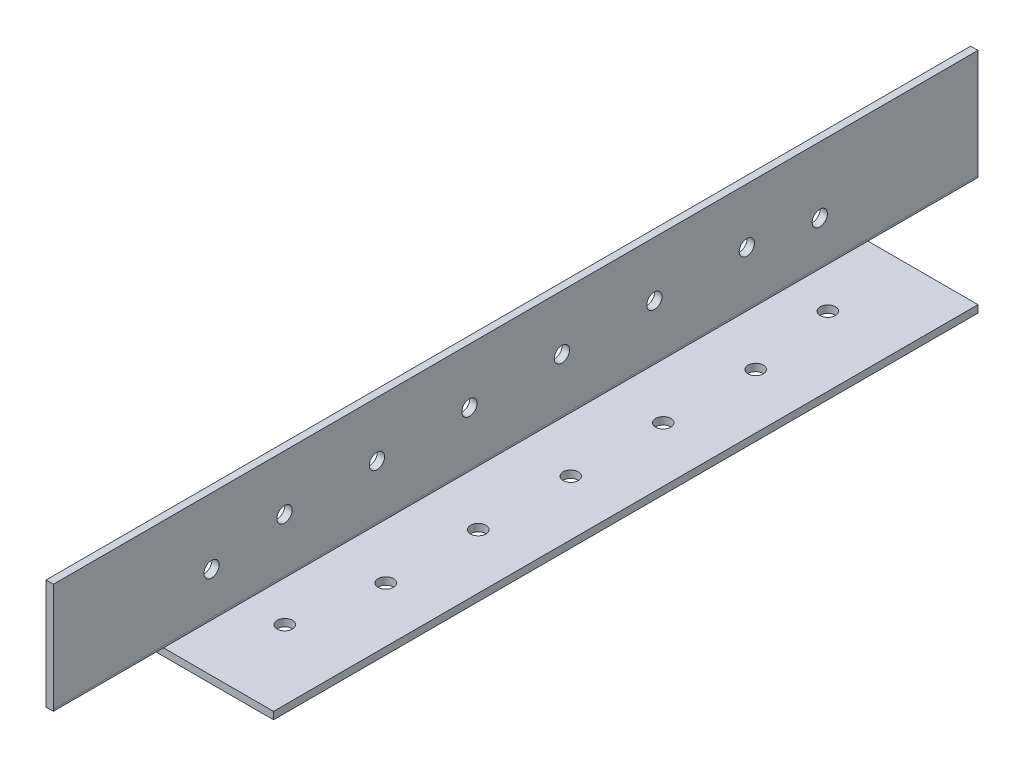
from build123d import *

# Parameters (mm, degrees)
BOSS_EXTRUDE1_DEPTH = 1219.2
FILLET1_R           = 0.254
SKETCH4_W           = 2238.4
SKETCH4_H           = 74.945320812
CUT_EXTRUDE1_DEPTH  = 60
SKETCH8_W           = 23.813
SKETCH8_H           = 23.813
CUT_EXTRUDE6_DEPTH  = 28.313
CUT_EXTRUDE7_DEPTH  = 228.313
SKETCH10_W          = 23.813
SKETCH10_H          = 1.587
CUT_EXTRUDE8_DEPTH  = 228.313
SKETCH14_R          = 1.65
CUT_EXTRUDE11_DEPTH = 60
SKETCH15_R          = 1.65
CUT_EXTRUDE12_DEPTH = 60


with BuildPart() as part:
    # Sketch3 → Boss-Extrude1 (new, symmetric)
    with BuildSketch(Plane.XY):
        Polygon((1.5875, 25.4), (0, 25.4), (0, 0), (25.4, 0), (25.4, 1.5875), (1.5875, 1.5875), align=None)
    extrude(amount=BOSS_EXTRUDE1_DEPTH, both=True)

    # Fillet1
    fillet1_edges = [part.edges().sort_by_distance(p)[0] for p in [
        (1.5875, 1.5875, 0),
    ]]
    fillet(fillet1_edges, radius=FILLET1_R)

    # Sketch4 → Cut-Extrude1 (cut)
    with BuildSketch(Plane.ZY):
        with Locations((-100, 37.472660406)):
            Rectangle(SKETCH4_W, SKETCH4_H)
    extrude(amount=-CUT_EXTRUDE1_DEPTH, mode=Mode.SUBTRACT)

    # Sketch8 → Cut-Extrude6 (cut)
    with BuildSketch(Plane(origin=(0, 1.5875, 0), x_dir=(1, 0, 0), z_dir=(0, 1, 0))):
        with Locations((13.4935, -1207.2935)):
            Rectangle(SKETCH8_W, SKETCH8_H)
        with Locations((13.4935, -1031.1065)):
            Rectangle(SKETCH8_W, SKETCH8_H)
    extrude(amount=-CUT_EXTRUDE6_DEPTH, mode=Mode.SUBTRACT)

    # Sketch9 → Cut-Extrude7 (cut)
    with BuildSketch(Plane(origin=(0, 0, 1019.2), x_dir=(-1, 0, 0), z_dir=(0, 0, -1))):
        Polygon((-1.8415, 1.5875), (-1.587, 1.5875), (-1.5875, 1.990327362), (-1.8415, 1.990327362), align=None)
    extrude(amount=-CUT_EXTRUDE7_DEPTH, mode=Mode.SUBTRACT)

    # Sketch10 → Cut-Extrude8 (cut)
    with BuildSketch(Plane.ZY):
        with Locations((1031.1065, 0.7935)):
            Rectangle(SKETCH10_W, SKETCH10_H)
        with Locations((1207.2935, 0.7935)):
            Rectangle(SKETCH10_W, SKETCH10_H)
    extrude(amount=-CUT_EXTRUDE8_DEPTH, mode=Mode.SUBTRACT)

    # Sketch14 → Cut-Extrude11 (cut)
    with BuildSketch(Plane(origin=(0, 1.5875, 0), x_dir=(1, 0, 0), z_dir=(0, 1, 0))):
        with Locations((10.3759, -1177.925)):
            Circle(SKETCH14_R)
        with Locations((10.3759, -1060.4755)):
            Circle(SKETCH14_R)
        with Locations((13.49375, -1079.20025)):
            Circle(SKETCH14_R)
        with Locations((13.49375, -1099.20025)):
            Circle(SKETCH14_R)
        with Locations((13.49375, -1119.20025)):
            Circle(SKETCH14_R)
        with Locations((13.49375, -1139.20025)):
            Circle(SKETCH14_R)
        with Locations((13.49375, -1159.20025)):
            Circle(SKETCH14_R)
    extrude(amount=-CUT_EXTRUDE11_DEPTH, mode=Mode.SUBTRACT)

    # Sketch15 → Cut-Extrude12 (cut)
    with BuildSketch(Plane(origin=(1.5875, 0, 0), x_dir=(0, 0, -1), z_dir=(1, 0, 0))):
        with Locations((-1184.978795667, 11.1125)):
            Circle(SKETCH15_R)
        with Locations((-1053.421204333, 11.1125)):
            Circle(SKETCH15_R)
        with Locations((-1069.2, 13.49375)):
            Circle(SKETCH15_R)
        with Locations((-1089.2, 13.49375)):
            Circle(SKETCH15_R)
        with Locations((-1109.2, 13.49375)):
            Circle(SKETCH15_R)
        with Locations((-1129.2, 13.49375)):
            Circle(SKETCH15_R)
        with Locations((-1149.2, 13.49375)):
            Circle(SKETCH15_R)
        with Locations((-1169.2, 13.49375)):
            Circle(SKETCH15_R)
    extrude(amount=-CUT_EXTRUDE12_DEPTH, mode=Mode.SUBTRACT)


solid = part.part
